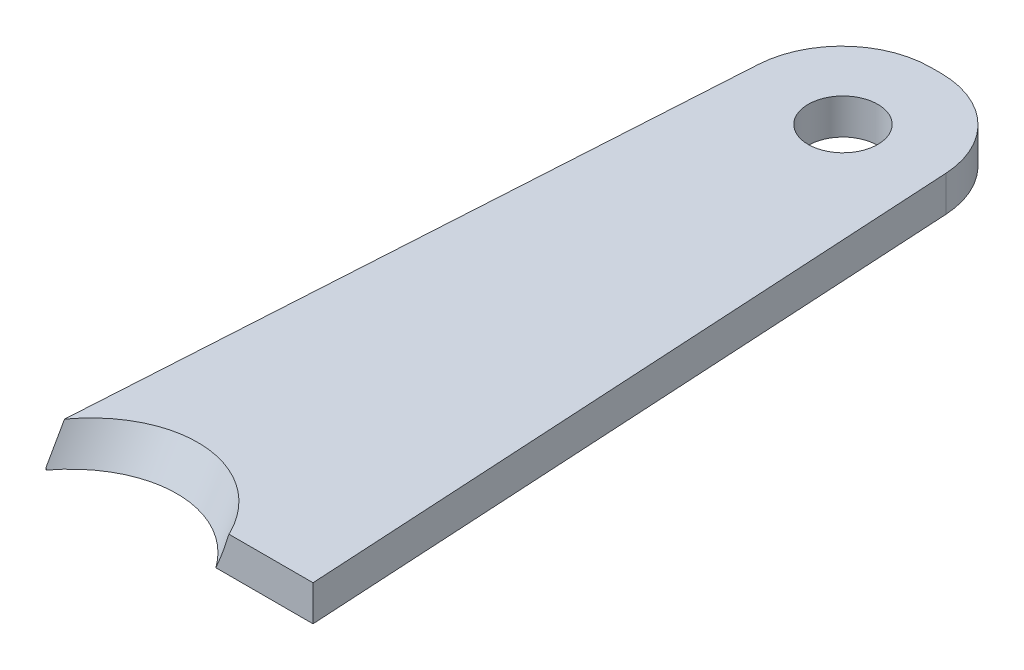
from build123d import *

# Parameters (mm, degrees)
SKETCH1_R           = 3.911052803
BOSS_EXTRUDE1_DEPTH = 4
CAVITY1_START       = 0.003221124
CAVITY1_DEPTH       = 7.362862002


# Read off the part's stored shape, not the designer's step: Cavity1
with BuildPart() as part:
    # Sketch1 → Boss-Extrude1 (new body)
    with BuildSketch(Plane(origin=(0, 0, 0), x_dir=(1, 0, 0), z_dir=(0, 1, 0))):
        with BuildLine():
            Line((0, 0), (30, 0))
            Line((30, 0), (25.709430043, 75.411524479))
            ThreePointArc((25.709430043, 75.411524479), (22.592877256, 82.112613927), (15.725576294, 84.84348898))
            Line((15.725576294, 84.84348898), (15.172794511, 84.84348898))
            Line((15.172794511, 84.84348898), (14.566572295, 84.84348898))
            ThreePointArc((14.566572295, 84.84348898), (7.713312448, 82.125853257), (4.584985356, 75.450054873))
            Line((4.584985356, 75.450054873), (0, 0))
        make_face()
        with Locations(Location((15.172794511, 74.362549593, 0), (0, 0, 270))):
            Circle(SKETCH1_R, mode=Mode.SUBTRACT)
    extrude(amount=BOSS_EXTRUDE1_DEPTH)

    # Cavity1 outline → Cavity1 (cut)
    with BuildSketch(Plane(origin=(0, 0, 0), x_dir=(0.9990997712006259, -0.037322908087554375, 0.02016550814496959), z_dir=(0.042422248724659405, 0.8790035901407052, -0.4749242479942401)).offset(CAVITY1_START)):
        with BuildLine():
            ThreePointArc((20.385742614, -1.901408695), (10.614392107, 4.37266206), (-0.069777809, -0.176158423))
            Line((-0.069777809, -0.176158423), (-2, -2.55511847))
            Line((-2, -2.55511847), (-2, -3))
            Line((-2, -3), (21.005093085, -3))
            Line((21.005093085, -3), (20.385742614, -1.901408695))
        make_face()
    extrude(amount=CAVITY1_DEPTH, mode=Mode.SUBTRACT)


solid = part.part
